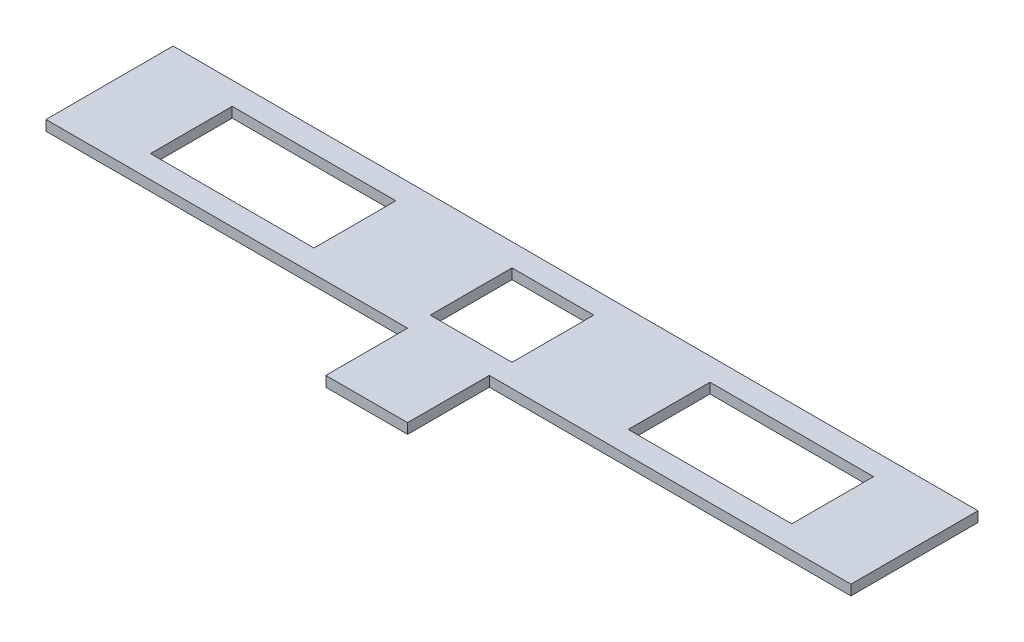
from build123d import *

# Parameters (mm, degrees)
SKETCH1_W           = 203.2
SKETCH1_H           = 101.6
SKETCH1_W_2         = 101.6
BOSS_EXTRUDE1_DEPTH = 12.7


with BuildPart() as part:
    # Sketch1 → Boss-Extrude1 (new body)
    with BuildSketch(Plane(origin=(0, 0, 0), x_dir=(1, 0, 0), z_dir=(0, 1, 0))):
        Polygon((0, 0), (0, 157.92405431), (1000.00054, 157.92405431), (1000.00054, 0), (550.80027, 0), (550.80027, -101.6), (449.20027, -101.6), (449.20027, 0), align=None)
        with Locations((203.2, 78.962027155)):
            Rectangle(SKETCH1_W, SKETCH1_H, mode=Mode.SUBTRACT)
        with Locations((500.00027, 78.962027155)):
            Rectangle(SKETCH1_W_2, SKETCH1_H, mode=Mode.SUBTRACT)
        with Locations((796.80054, 78.962027155)):
            Rectangle(SKETCH1_W, SKETCH1_H, mode=Mode.SUBTRACT)
    extrude(amount=BOSS_EXTRUDE1_DEPTH)


solid = part.part
